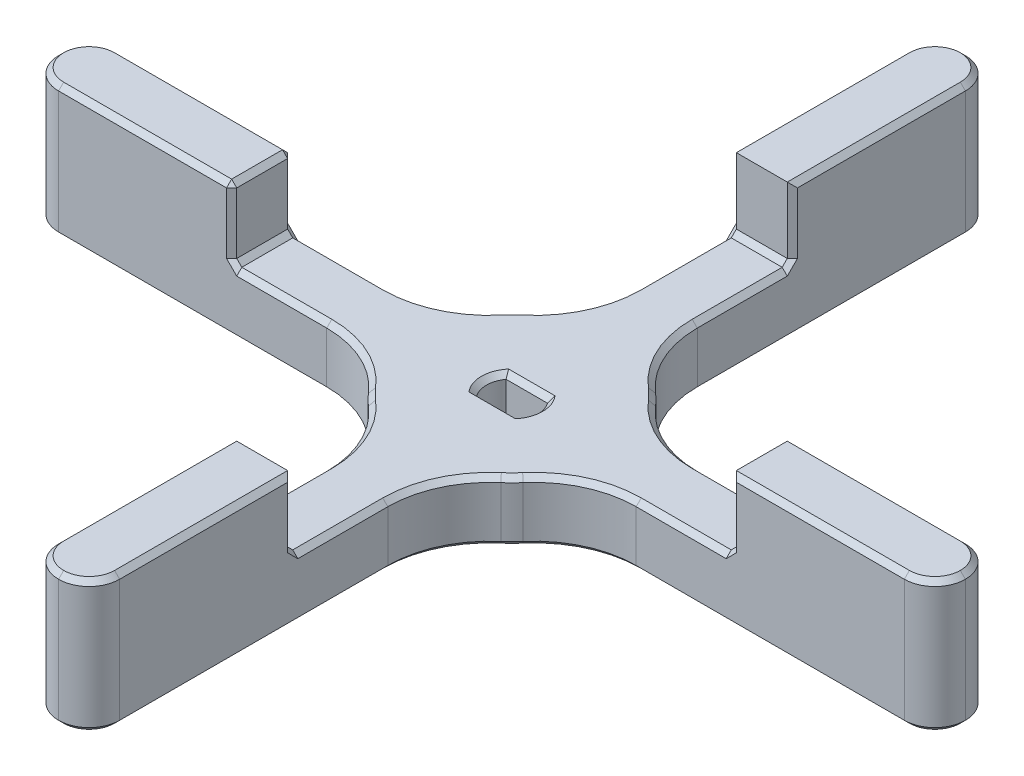
from build123d import *

# Parameters (mm, degrees)
SKETCH1_R           = 10
SKETCH1_R_2         = 2.5
BOSS_EXTRUDE1_DEPTH = 6
SKETCH2_W           = 35
SKETCH2_H           = 6
SKETCH2_W_2         = 6
SKETCH2_H_2         = 35
BOSS_EXTRUDE2_DEPTH = 6
SKETCH3_W           = 20
SKETCH3_H           = 6
SKETCH3_W_2         = 6
SKETCH3_H_2         = 20
BOSS_EXTRUDE3_DEPTH = 7
FILLET1_R           = 10
FILLET2_R           = 3
CHAMFER1_SIZE       = 0.5


with BuildPart() as part:
    # Sketch1 → Boss-Extrude1 (new body)
    # profile 1 of 3: a face of its own
    with BuildSketch(Plane(origin=(0, 0, 0), x_dir=(1, 0, 0), z_dir=(0, 1, 0))):
        with Locations(Location((0, 0, 0), (0, 0, 270))):
            Circle(SKETCH1_R)
        Circle(SKETCH1_R_2, mode=Mode.SUBTRACT)
    # profile 2 of 3: a face of its own
    with BuildSketch(Plane(origin=(0, 0, 0), x_dir=(1, 0, 0), z_dir=(0, 1, 0))):
        with BuildLine():
            ThreePointArc((2.036541185, 1.45), (0, 2.5), (-2.036541185, 1.45))
            Line((-2.036541185, 1.45), (2.036541185, 1.45))
        make_face()
    # profile 3 of 3: a face of its own
    with BuildSketch(Plane(origin=(0, 0, 0), x_dir=(1, 0, 0), z_dir=(0, 1, 0))):
        with BuildLine():
            Line((2.036541185, -1.45), (-2.036541185, -1.45))
            ThreePointArc((-2.036541185, -1.45), (0, -2.5), (2.036541185, -1.45))
        make_face()
    extrude(amount=BOSS_EXTRUDE1_DEPTH)

    # Sketch2 → Boss-Extrude2 (add)
    with BuildSketch(Plane(origin=(0, 6, 0), x_dir=(1, 0, 0), z_dir=(0, 1, 0))):
        with Locations((27.039392014, 0)):
            Rectangle(SKETCH2_W, SKETCH2_H)
        with Locations((0, 27.039392014)):
            Rectangle(SKETCH2_W_2, SKETCH2_H_2)
        with Locations((0, -27.039392014)):
            Rectangle(SKETCH2_W_2, SKETCH2_H_2)
        with Locations((-27.039392014, 0)):
            Rectangle(SKETCH2_W, SKETCH2_H)
    extrude(amount=-BOSS_EXTRUDE2_DEPTH)

    # Sketch3 → Boss-Extrude3 (add)
    with BuildSketch(Plane(origin=(0, 6, 0), x_dir=(1, 0, 0), z_dir=(0, 1, 0))):
        with Locations((-34.539392014, 0)):
            Rectangle(SKETCH3_W, SKETCH3_H)
        with Locations((0, 34.539392014)):
            Rectangle(SKETCH3_W_2, SKETCH3_H_2)
        with Locations((34.539392014, 0)):
            Rectangle(SKETCH3_W, SKETCH3_H)
        with Locations((0, -34.539392014)):
            Rectangle(SKETCH3_W_2, SKETCH3_H_2)
    extrude(amount=BOSS_EXTRUDE3_DEPTH)

    # Fillet1
    fillet1_edges = [part.edges().sort_by_distance(p)[0] for p in [
        (-3, 3, -9.539392014),
        (3, 3, -9.539392014),
        (9.539392014, 3, -3),
        (9.539392014, 3, 3),
        (3, 3, 9.539392014),
        (-3, 3, 9.539392014),
        (-9.539392014, 3, 3),
        (-9.539392014, 3, -3),
    ]]
    fillet(fillet1_edges, radius=FILLET1_R)

    # Fillet2
    fillet2_edges = [part.edges().sort_by_distance(p)[0] for p in [
        (44.539392014, 6.5, -3),
        (44.539392014, 6.5, 3),
        (3, 6.5, 44.539392014),
        (-3, 6.5, 44.539392014),
        (-44.539392014, 6.5, 3),
        (-44.539392014, 6.5, -3),
        (3, 6.5, -44.539392014),
        (-3, 6.5, -44.539392014),
    ]]
    fillet(fillet2_edges, radius=FILLET2_R - 0.0001)  # a hair under: the kernel refuses the full size

    # Chamfer1
    chamfer1_edges = [part.edges().sort_by_distance(p)[0] for p in [
        (19.869038084, 6, -3),
        (24.539392014, 6, 0),
        (24.539392014, 9.5, -3),
        (24.539392014, 9.5, 3),
        (33.039442014, 13, 3),
        (0, 6, 1.45),
        (3, 6, 19.869038084),
        (0, 6, 24.539392014),
        (3, 9.5, 24.539392014),
        (-3, 9.5, 24.539392014),
        (-3, 13, 33.039442014),
        (28.369088084, 0, -3),
        (7.071067812, 6, -7.071067812),
        (7.071067812, 0, -7.071067812),
        (3, 6, -19.869038084),
        (-3, 0, -28.369088084),
        (-7.071067812, 0, -7.071067812),
        (-7.071067812, 6, -7.071067812),
        (-19.869038084, 6, -3),
        (-28.369088084, 0, 3),
        (-7.071067812, 6, 7.071067812),
        (-7.071067812, 0, 7.071067812),
        (-3, 6, 19.869038084),
        (3, 0, 28.369088084),
        (7.071067812, 6, 7.071067812),
        (7.071067812, 0, 7.071067812),
        (19.869038084, 6, 3),
        (11.015384021, 6, -3.917048938),
        (11.015384021, 0, -3.917048938),
        (3.917048938, 6, -11.015384021),
        (3.917048938, 0, -11.015384021),
        (-3.917048938, 6, -11.015384021),
        (-3.917048938, 0, -11.015384021),
        (-2.5, 6, 0),
        (-11.015384021, 6, -3.917048938),
        (-11.015384021, 0, -3.917048938),
        (-11.015384021, 6, 3.917048938),
        (-11.015384021, 0, 3.917048938),
        (-3.917048938, 6, 11.015384021),
        (-3.917048938, 0, 11.015384021),
        (3.917048938, 6, 11.015384021),
        (3.917048938, 0, 11.015384021),
        (11.015384021, 6, 3.917048938),
        (11.015384021, 0, 3.917048938),
        (0, 6, -1.45),
        (33.039442014, 13, -3),
        (43.660741647, 13, 2.121349633),
        (43.660741647, 13, -2.121349633),
        (-28.369088084, 0, -3),
        (3, 0, -28.369088084),
        (28.369088084, 0, 3),
        (-3, 0, 28.369088084),
        (-2.121349633, 0, -43.660741647),
        (2.121349633, 0, -43.660741647),
        (-43.660741647, 0, -2.121349633),
        (-43.660741647, 0, 2.121349633),
        (-2.121349633, 0, 43.660741647),
        (2.121349633, 0, 43.660741647),
        (43.660741647, 0, 2.121349633),
        (43.660741647, 0, -2.121349633),
        (3, 13, 33.039442014),
        (-2.121349633, 13, 43.660741647),
        (2.121349633, 13, 43.660741647),
        (-33.039442014, 13, 3),
        (-43.660741647, 13, -2.121349633),
        (-43.660741647, 13, 2.121349633),
        (-3, 13, -33.039442014),
        (-2.121349633, 13, -43.660741647),
        (2.121349633, 13, -43.660741647),
        (2.5, 6, 0),
        (0, 0, -1.45),
        (-2.5, 0, 0),
        (0, 0, 1.45),
        (-19.869038084, 6, 3),
        (-24.539392014, 6, 0),
        (-24.539392014, 9.5, 3),
        (-24.539392014, 9.5, -3),
        (2.5, 0, 0),
        (-24.539392014, 13, 0),
        (-33.039442014, 13, -3),
        (-3, 6, -19.869038084),
        (0, 6, -24.539392014),
        (-3, 9.5, -24.539392014),
        (3, 9.5, -24.539392014),
        (3, 13, -33.039442014),
    ]]
    chamfer(chamfer1_edges, length=CHAMFER1_SIZE)


solid = part.part
